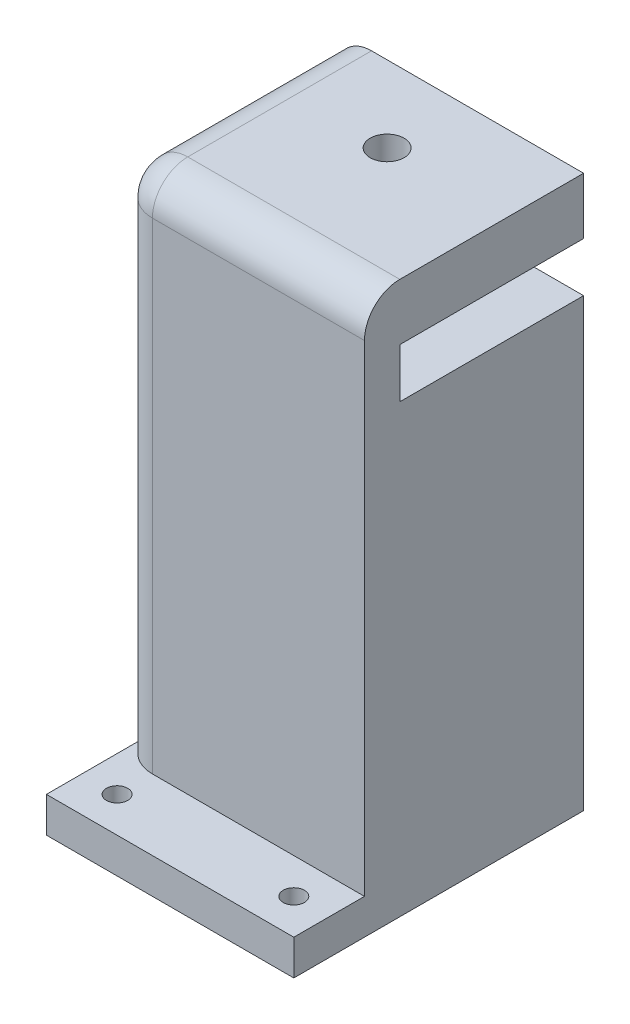
from build123d import *

# Parameters (mm, degrees)
SKETCH1_W           = 35
SKETCH1_H           = 41
BOSS_EXTRUDE1_DEPTH = 5
SKETCH2_R           = 1.5
CUT_EXTRUDE1_DEPTH  = 5
SKETCH3_W           = 35
SKETCH3_H           = 31
BOSS_EXTRUDE2_DEPTH = 73.1
SKETCH4_W           = 26
SKETCH4_H           = 7
CUT_EXTRUDE2_DEPTH  = 30
SKETCH5_R           = 2.4
CUT_EXTRUDE3_DEPTH  = 8
FILLET1_R           = 5
FILLET2_R           = 5


with BuildPart() as part:
    # Sketch1 → Boss-Extrude1 (new body)
    with BuildSketch(Plane(origin=(0, 0, 0), x_dir=(1, 0, 0), z_dir=(0, 1, 0))):
        with Locations((17.5, 20.5)):
            Rectangle(SKETCH1_W, SKETCH1_H)
    extrude(amount=BOSS_EXTRUDE1_DEPTH)

    # Sketch2 → Cut-Extrude1 (cut)
    with BuildSketch(Plane(origin=(0, 5, 0), x_dir=(1, 0, 0), z_dir=(0, 1, 0))):
        with Locations((5, 5)):
            Circle(SKETCH2_R)
        with Locations((30, 5)):
            Circle(SKETCH2_R)
    extrude(amount=-CUT_EXTRUDE1_DEPTH, mode=Mode.SUBTRACT)

    # Sketch3 → Boss-Extrude2 (add)
    with BuildSketch(Plane(origin=(0, 5, 0), x_dir=(1, 0, 0), z_dir=(0, 1, 0))):
        with Locations((17.5, 25.5)):
            Rectangle(SKETCH3_W, SKETCH3_H)
    extrude(amount=BOSS_EXTRUDE2_DEPTH)

    # Sketch4 → Cut-Extrude2 (cut)
    with BuildSketch(Plane(origin=(35, 0, 0), x_dir=(0, 0, -1), z_dir=(1, 0, 0))):
        with Locations((28, 66.6)):
            Rectangle(SKETCH4_W, SKETCH4_H)
    extrude(amount=-CUT_EXTRUDE2_DEPTH, mode=Mode.SUBTRACT)

    # Sketch5 → Cut-Extrude3 (cut)
    with BuildSketch(Plane(origin=(0, 78.1, 0), x_dir=(1, 0, 0), z_dir=(0, 1, 0))):
        with Locations((18, 30.202102686)):
            Circle(SKETCH5_R)
    extrude(amount=-CUT_EXTRUDE3_DEPTH, mode=Mode.SUBTRACT)

    # Fillet1
    fillet1_edges = [part.edges().sort_by_distance(p)[0] for p in [
        (0, 78.1, -25.5),
    ]]
    fillet(fillet1_edges, radius=FILLET1_R)

    # Fillet2
    fillet2_edges = [part.edges().sort_by_distance(p)[0] for p in [
        (0, 39.05, -10),
        (1.464466094, 76.635533906, -10),
        (20, 78.1, -10),
    ]]
    fillet(fillet2_edges, radius=FILLET2_R)


solid = part.part
